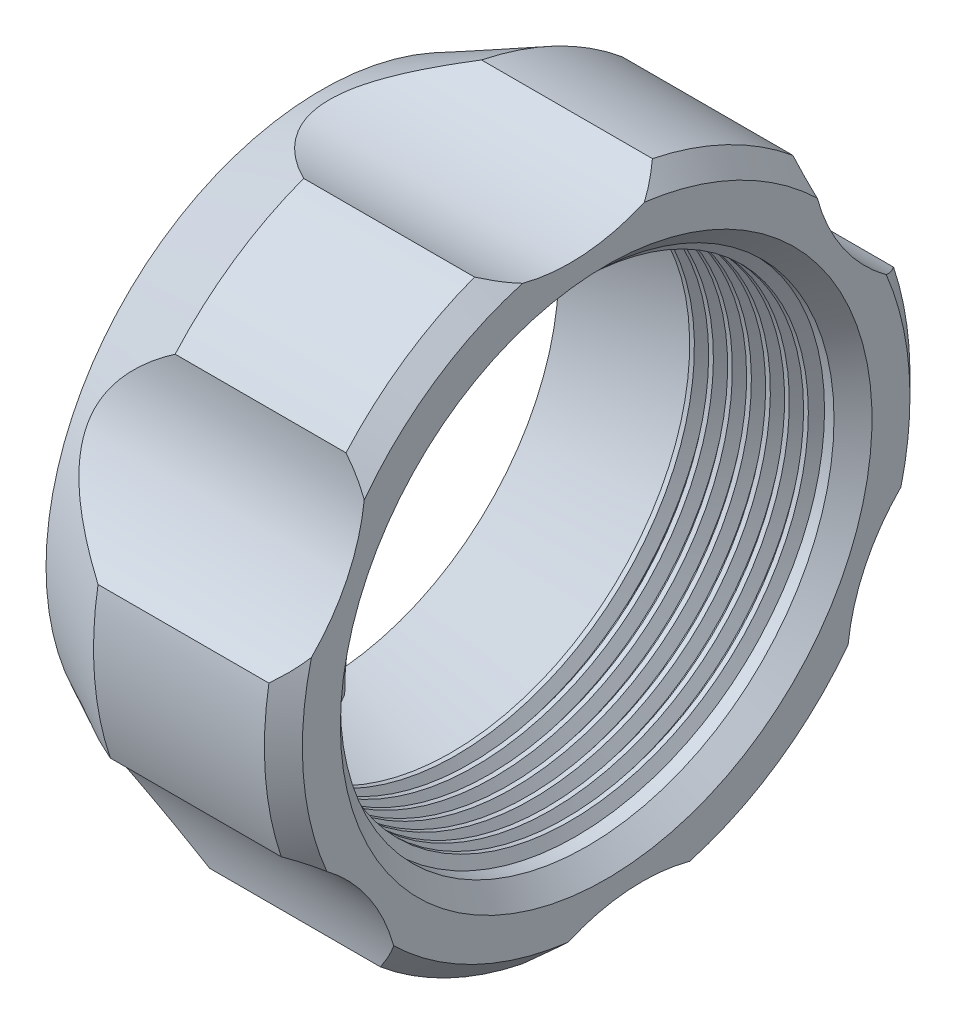
from build123d import *

# Parameters (mm, degrees)
CHAMFER_1_SIZE      = 1
CHAMFER_2_SIZE      = 1
THREAD_1_PITCH      = 1
SKETCH_4_R          = 9.694281534
SKETCH_4_R_2        = 9.643520476
CUT_EXTRUDE_1_DEPTH = 15


with BuildPart() as part:
    # Sketch 1 → Повернуть1 (revolve)
    with BuildSketch(Plane(origin=(0, 0, 0), x_dir=(1, 0, 0), z_dir=(0, 1, 0)), mode=Mode.PRIVATE) as revolve_1_sk:
        Polygon((30.637306964, 19.003559373), (20.637306964, 19.003559373), (15.637306964, 16.503559373), (15.637306964, 14.503559373), (21.637306964, 17.003559373), (23.637306964, 15.003559373), (30.637306964, 15.003559373), align=None)
    revolve(revolve_1_sk.sketch.rotate(Axis((0, 0, -2.003559373), (1, 0, 0)), 180), axis=Axis((0, 0, -2.003559373), (1, 0, 0)))

    # Фаска1
    chamfer_1_edges = [part.edges().sort_by_distance(p)[0] for p in [
        (30.637306964, 0, -19.003559373),
    ]]
    chamfer(chamfer_1_edges, length=CHAMFER_1_SIZE)

    # Фаска2
    chamfer_2_edges = [part.edges().sort_by_distance(p)[0] for p in [
        (30.637306964, 0, -15.003559373),
    ]]
    chamfer(chamfer_2_edges, length=CHAMFER_2_SIZE)

    # Резьба1: the profile of Sketch 1 2 profile screwed along a right-hand helix of 7 turns, 8 arcs to a turn; built about Z, then put on its axis
    thread_1_z = Axis((0, 0, 0), (0, 0, 1))
    thread_1_corners = [(13.0003, 0, -0.000173205), (13.0003, 0, 0.875173202), (12.458734125, 0, 0.562499998), (12.458734125, 0, 0.312499998)]
    with BuildLine(mode=Mode.PRIVATE) as thread_1_profile:
        Line(thread_1_corners[0], thread_1_corners[1])
        Line(thread_1_corners[1], thread_1_corners[2])
        Line(thread_1_corners[2], thread_1_corners[3])
        Line(thread_1_corners[3], thread_1_corners[0])
    thread_1_cap = Face(thread_1_profile.wire())
    thread_1_turn_angles = [0, 22.5, 45, 67.5, 90, 112.5, 135, 157.5, 180, 202.5, 225, 247.5, 270, 292.5, 315, 337.5, 360]
    thread_1_turn_weights = [1, 0.9238795325112867, 1, 0.9238795325112867, 1, 0.9238795325112867, 1, 0.9238795325112867, 1, 0.9238795325112867, 1, 0.9238795325112867, 1, 0.9238795325112867, 1, 0.9238795325112867, 1]
    thread_1_turn_rails = [Edge.make_bspline([Vector(p[0], p[1], 0).rotate(thread_1_z, thread_1_turn_angles[k]) / thread_1_turn_weights[k] + Vector(0, 0, p[2] + THREAD_1_PITCH * thread_1_turn_angles[k] / 360) for k in range(17)], [0, 0, 0, 1, 1, 2, 2, 3, 3, 4, 4, 5, 5, 6, 6, 7, 7, 8, 8, 8], 2, thread_1_turn_weights) for p in thread_1_corners]
    thread_1_turn_sides = [Face.make_surface_from_curves(thread_1_turn_rails[p[0]], thread_1_turn_rails[p[1]]) for p in [(0, 1), (1, 2), (2, 3), (3, 0)]]
    thread_1 = Plane(origin=(29.637306964, 0, -2.003559373), x_dir=(0, 0, 1), z_dir=(-1, 0, 0)) * Solid(Shell([*[p.moved(Location((0, 0, THREAD_1_PITCH * i))) for i in range(7) for p in thread_1_turn_sides], thread_1_cap, thread_1_cap.rotate(thread_1_z, 2520).moved(Location((0, 0, THREAD_1_PITCH * 2520 / 360)))]))
    add(thread_1)

    # Эскиз4 → Вырез-Вытянуть1 (cut)
    with BuildSketch(Plane(origin=(30.637306964, 0, 0), x_dir=(0, 0, -1), z_dir=(1, 0, 0))):
        with Locations((-20.375257064, 10.729829035)):
            Circle(SKETCH_4_R)
        with Locations((-18.478153368, -14.015709023)):
            Circle(SKETCH_4_R_2)
        with Locations((3.900663069, -24.745538059)):
            Circle(SKETCH_4_R)
        with Locations((24.38237581, -10.729829035)):
            Circle(SKETCH_4_R)
        with Locations((22.485272115, 14.015709023)):
            Circle(SKETCH_4_R)
        with Locations((0.106455678, 24.745538059)):
            Circle(SKETCH_4_R)
    extrude(amount=-CUT_EXTRUDE_1_DEPTH, mode=Mode.SUBTRACT)


solid = part.part
